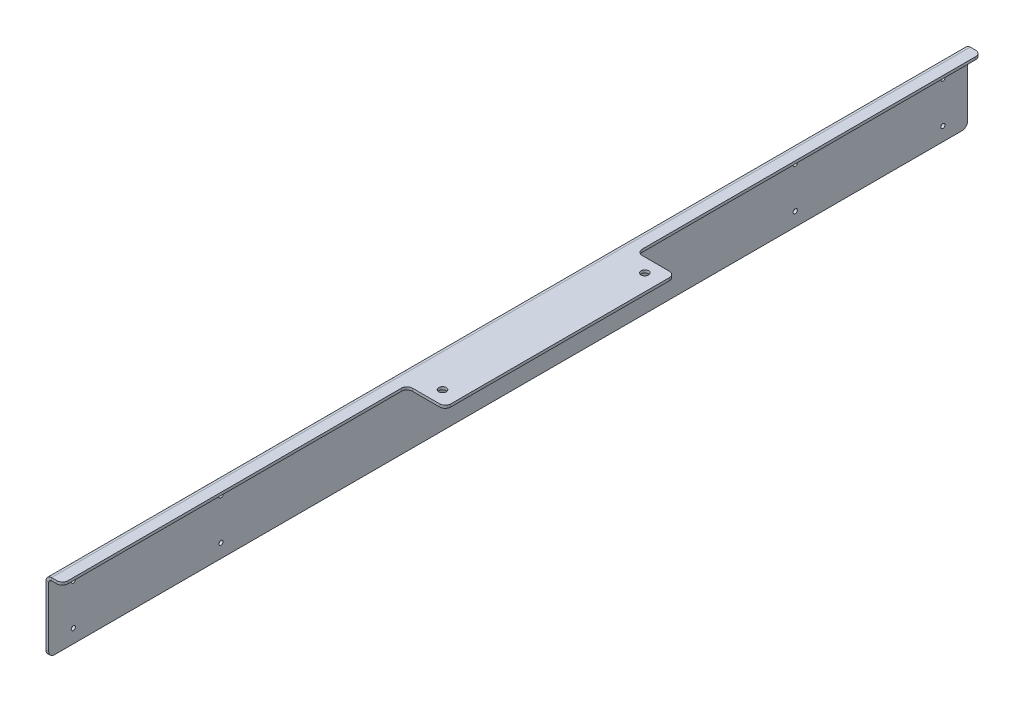
from build123d import *

# Parameters (mm, degrees)
SKETCH1_W                    = 1066.8
SKETCH1_H                    = 82.55
BASE_FLANGE1_DEPTH           = 3.175
EDGE_FLANGE1_STRIP_W         = 19.05
EDGE_FLANGE1_STRIP_H         = 3.175
EDGE_FLANGE1_STRIP_CUT_DEPTH = 1066.8
EDGE_FLANGE1_DEPTH           = 1066.8
SKETCH9_R                    = 2.45745
CUT_EXTRUDE1_DEPTH           = 1072.688316688
SKETCH10_R                   = 4.3688
CUT_EXTRUDE2_DEPTH           = 3.175
FILLET1_R                    = 6.35


# Sheet-metal steps are written as plain solids
with BuildPart() as part:
    # Sketch1 → Base-Flange1 (new body)
    with BuildSketch(Plane(origin=(0, 0, 0), x_dir=(0, 0, -1), z_dir=(1, 0, 0))):
        with Locations((533.4, 41.275)):
            Rectangle(SKETCH1_W, SKETCH1_H)
    extrude(amount=-BASE_FLANGE1_DEPTH)

    # Edge-Flange1 strip (across the edge) → Edge-Flange1 strip cut (cut)
    with BuildSketch(Plane(origin=(0, 82.55, -1066.8), x_dir=(0, -1, 0), z_dir=(0, 0, 1))):
        with Locations((-3.175, -1.5875)):
            Rectangle(EDGE_FLANGE1_STRIP_W, EDGE_FLANGE1_STRIP_H)
    extrude(amount=EDGE_FLANGE1_STRIP_CUT_DEPTH, mode=Mode.SUBTRACT)

    # Edge-Flange1 section (across the edge) → Edge-Flange1 (add)
    with BuildSketch(Plane(origin=(0, 82.55, -1066.8), x_dir=(0, -1, 0), z_dir=(0, 0, 1))):
        with BuildLine():
            Line((0, 3.175), (0, 60.325))
            Line((0, 60.325), (3.175, 60.325))
            Line((3.175, 60.325), (3.175, 3.175))
            ThreePointArc((3.175, 3.175), (4.10493597, 0.92993597), (6.35, 0))
            Line((6.35, 0), (6.35, -3.175))
            ThreePointArc((6.35, -3.175), (1.859871939, -1.315128061), (0, 3.175))
        make_face()
    extrude(amount=EDGE_FLANGE1_DEPTH)

    # Sketch9 → Cut-Extrude1 (cut, through all)
    with BuildSketch(Plane(origin=(0, 0, 0), x_dir=(0, 0, -1), z_dir=(1, 0, 0))):
        with Locations((28.575, 63.5)):
            Circle(SKETCH9_R)
        with Locations((200.025, 63.5)):
            Circle(SKETCH9_R)
        with Locations((28.575, 15.875)):
            Circle(SKETCH9_R)
        with Locations((200.025, 15.875)):
            Circle(SKETCH9_R)
        with Locations(Location((866.775, 63.5, 0), (0, 0, 180))):
            Circle(SKETCH9_R)
        with Locations(Location((866.775, 15.875, 0), (0, 0, 180))):
            Circle(SKETCH9_R)
        with Locations(Location((1038.225, 15.875, 0), (0, 0, 180))):
            Circle(SKETCH9_R)
        with Locations(Location((1038.225, 63.5, 0), (0, 0, 180))):
            Circle(SKETCH9_R)
    extrude(amount=-CUT_EXTRUDE1_DEPTH, mode=Mode.SUBTRACT)

    # Sketch10 → Cut-Extrude2 (cut)
    with BuildSketch(Plane(origin=(0, 82.55, 0), x_dir=(1, 0, 0), z_dir=(0, 1, 0))):
        with Locations(Location((41.275, 650.875, 0), (0, 0, 180))):
            Circle(SKETCH10_R)
        with Locations(Location((41.275, 415.925, 0), (0, 0, 180))):
            Circle(SKETCH10_R)
        Polygon((15.875, 1066.8), (79.375, 1066.8), (79.375, 0), (15.875, 0), (15.875, 400.05), (60.325, 400.05), (60.325, 666.75), (15.875, 666.75), align=None)
    extrude(amount=-CUT_EXTRUDE2_DEPTH, mode=Mode.SUBTRACT)

    # Fillet1
    fillet1_edges = [part.edges().sort_by_distance(p)[0] for p in [
        (15.875, 80.9625, -1066.8),
        (15.875, 80.9625, -666.75),
        (15.875, 80.9625, 0),
        (15.875, 80.9625, -400.05),
        (60.325, 80.9625, -400.05),
        (60.325, 80.9625, -666.75),
        (-1.5875, 0, 0),
        (-1.5875, 0, -1066.8),
    ]]
    fillet(fillet1_edges, radius=FILLET1_R)


solid = part.part
